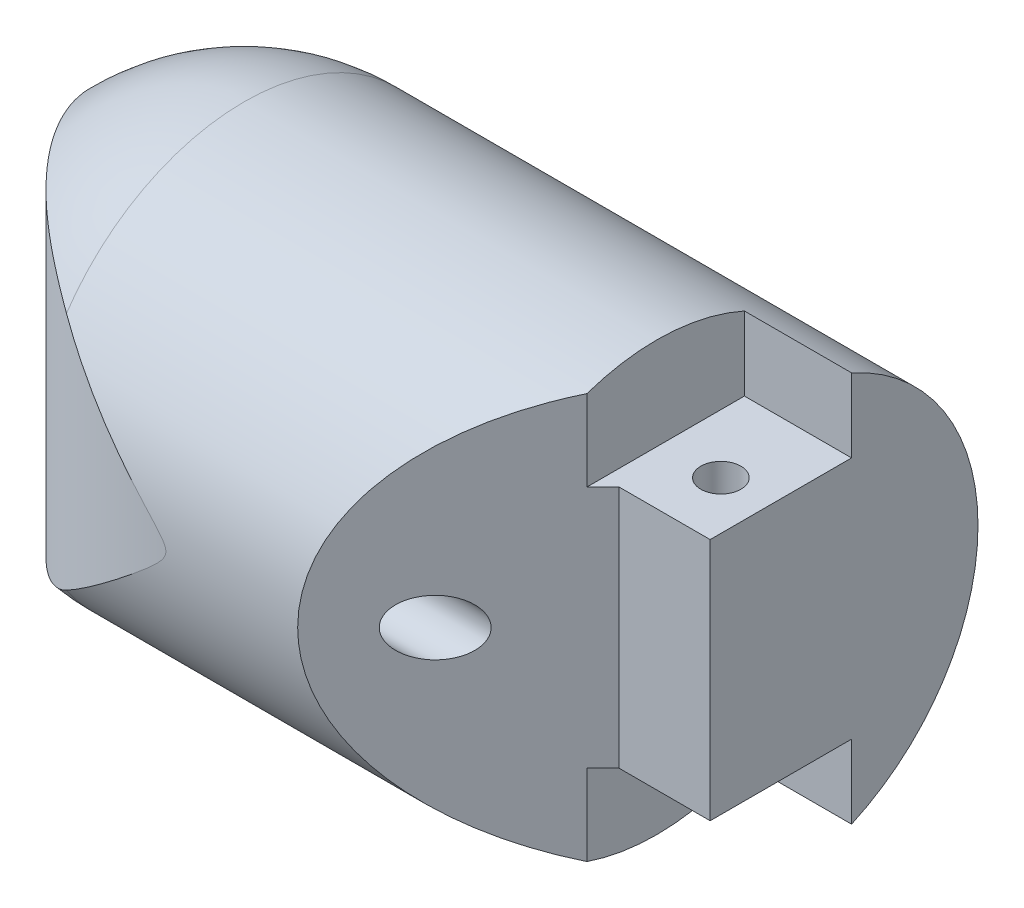
from build123d import *

# Parameters (mm, degrees)
SKETCH1_R                = 10
BOSS_EXTRUDE1_DEPTH      = 20
CUT_EXTRUDE10_DEPTH      = 12
CUT_EXTRUDE10_DEPTH_BACK = 12
CUT_SWEEP1_START         = -6.209273082
CUT_SWEEP1_OUTLINE_R     = 1.305
CUT_SWEEP1_DEPTH         = 3
CUT_SWEEP1_START_2       = 11.29177872
CUT_SWEEP1_2_OUTLINE_R   = 1.305
CUT_SWEEP1_2_DEPTH       = 8.70822128
CUT_SWEEP1_3_OUTLINE_R   = 1.305
CUT_SWEEP1_3_ANGLE       = 90
CUT_SWEEP2_START         = -11
CUT_SWEEP2_OUTLINE_R     = 2.5
CUT_SWEEP2_DEPTH         = 4.790726918
SKETCH25_W               = 5
SKETCH25_H               = 11.364916732
BOSS_EXTRUDE3_DEPTH      = 4.25
BOSS_EXTRUDE4_DEPTH      = 4.25
SKETCH27_R               = 0.935
CUT_EXTRUDE11_DEPTH      = 17.125
CUT_EXTRUDE12_START      = -0.75
CUT_EXTRUDE12_DEPTH      = 0.75
CUT_EXTRUDE13_DEPTH      = 10.375
SKETCH30_W               = 5
SKETCH30_H               = 4
CUT_EXTRUDE14_DEPTH      = 1.6
SCALE2_SCALE             = 0.8


with BuildPart() as part:
    # Sketch1 → Boss-Extrude1 (new body)
    with BuildSketch(Plane(origin=(0, 0, 0), x_dir=(0, 0, -1), z_dir=(1, 0, 0))):
        Circle(SKETCH1_R)
    extrude(amount=BOSS_EXTRUDE1_DEPTH)

    # Sketch12 → Revolve1 (revolve)
    with BuildSketch(Plane.XY):
        with BuildLine():
            Line((0, 10), (0, -10))
            ThreePointArc((0, -10), (-10, 0), (0, 10))
        make_face()
    revolve(axis=Axis((0, 10, 0), (0, -1, 0)))

    # Sketch13 → Cut-Extrude10 (cut, two sides: drawn at the far end of the back side and taken through both)
    with BuildSketch(Plane(origin=(0, 0, 0), x_dir=(1, 0, 0), z_dir=(0, 1, 0)).offset(-CUT_EXTRUDE10_DEPTH_BACK)):
        with BuildLine():
            ThreePointArc((-7.984675672, 6.020378262), (-3.764408562, -5.478068678), (7.618784032, -10))
            ThreePointArc((7.618784032, -10), (-7.804645707, -9.413161624), (-7.984675672, 6.020378262))
        make_face()
    extrude(amount=CUT_EXTRUDE10_DEPTH + CUT_EXTRUDE10_DEPTH_BACK, mode=Mode.SUBTRACT)

    # Cut-Sweep1: read off the stored shape, not the designer's step
    # Cut-Sweep1 outline → Cut-Sweep1 (cut)
    with BuildSketch(Plane.XY.offset(CUT_SWEEP1_START)):
        with Locations((1.29177882, 0)):
            Circle(CUT_SWEEP1_OUTLINE_R)
    extrude(amount=CUT_SWEEP1_DEPTH, mode=Mode.SUBTRACT)

    # Cut-Sweep1 2 outline → Cut-Sweep1 2 (cut)
    with BuildSketch(Plane.YZ.offset(CUT_SWEEP1_START_2)):
        with Locations((0, 6.790726918)):
            Circle(CUT_SWEEP1_2_OUTLINE_R)
    extrude(amount=CUT_SWEEP1_2_DEPTH, mode=Mode.SUBTRACT)

    # Cut-Sweep1 3 outline → Cut-Sweep1 3 (revolve, cut)
    with BuildSketch(Plane(origin=(11.29177882, 0, -3.209273082), x_dir=(-1, 0, 0), z_dir=(0, 0, -1))):
        with Locations((10, 0)):
            Circle(CUT_SWEEP1_3_OUTLINE_R)
    revolve(axis=Axis((11.29177882, 0, -3.209273082), (0, 1, 0)), revolution_arc=CUT_SWEEP1_3_ANGLE, mode=Mode.SUBTRACT)

    # Cut-Sweep2: read off the stored shape, not the designer's step
    # Cut-Sweep2 outline → Cut-Sweep2 (cut)
    with BuildSketch(Plane.XY.offset(CUT_SWEEP2_START)):
        with Locations((1.29177882, 0)):
            Circle(CUT_SWEEP2_OUTLINE_R)
    extrude(amount=CUT_SWEEP2_DEPTH, mode=Mode.SUBTRACT)

    # Sketch25 → Boss-Extrude3 (add)
    with BuildSketch(Plane(origin=(20, 0, 0), x_dir=(0, 0, -1), z_dir=(1, 0, 0))):
        Rectangle(SKETCH25_W, SKETCH25_H)
    extrude(amount=BOSS_EXTRUDE3_DEPTH)

    # Sketch26 → Boss-Extrude4 (add)
    with BuildSketch(Plane(origin=(20, 0, 0), x_dir=(0, 0, -1), z_dir=(1, 0, 0))):
        with BuildLine():
            Line((2.5, -9.682458366), (2.5, 9.682458366))
            ThreePointArc((2.5, 9.682458366), (10, 0), (2.5, -9.682458366))
        make_face()
    extrude(amount=BOSS_EXTRUDE4_DEPTH)

    # Sketch27 → Cut-Extrude11 (cut, symmetric)
    with BuildSketch(Plane(origin=(0, 0, 0), x_dir=(1, 0, 0), z_dir=(0, 1, 0))):
        with Locations(Location((22, 0.25, 0), (0, 0, 270))):
            Circle(SKETCH27_R)
    extrude(amount=CUT_EXTRUDE11_DEPTH, both=True, mode=Mode.SUBTRACT)

    # Sketch28 → Cut-Extrude12 (cut)
    with BuildSketch(Plane(origin=(20, 0, 0), x_dir=(0, 0, -1), z_dir=(1, 0, 0)).offset(CUT_EXTRUDE12_START)):
        with BuildLine():
            Line((2.5, -9.682458366), (2.5, -5.682458366))
            Line((2.5, -5.682458366), (-8.228588392, -5.682458366))
            ThreePointArc((-8.228588392, -5.682458366), (-3.493448331, -9.369942303), (2.5, -9.682458366))
        make_face()
        with BuildLine():
            Line((-8.228588392, 5.682458366), (2.5, 5.682458366))
            Line((2.5, 5.682458366), (2.5, 9.682458366))
            ThreePointArc((2.5, 9.682458366), (-3.493448331, 9.369942303), (-8.228588392, 5.682458366))
        make_face()
    extrude(amount=CUT_EXTRUDE12_DEPTH, mode=Mode.SUBTRACT)

    # Sketch29 → Cut-Extrude13 (cut, symmetric)
    with BuildSketch(Plane(origin=(0, 0, 0), x_dir=(1, 0, 0), z_dir=(0, 1, 0))):
        Polygon((20, -8.228588392), (20, -2.5), (12.5, -10), (20, -10), align=None)
    extrude(amount=CUT_EXTRUDE13_DEPTH, both=True, mode=Mode.SUBTRACT)

    # Sketch30 → Cut-Extrude14 (cut)
    with BuildSketch(Plane.XY.offset(-2.5)):
        with Locations((21.75, 7.682458366)):
            Rectangle(SKETCH30_W, SKETCH30_H)
        with Locations((21.75, -7.682458366)):
            Rectangle(SKETCH30_W, SKETCH30_H)
    extrude(amount=-CUT_EXTRUDE14_DEPTH, mode=Mode.SUBTRACT)


with BuildPart() as part_1:
    # Scale2: scaled about (8.050299805, 3.9953e-05, -0.823625188)
    add(part.part.scale(SCALE2_SCALE).moved(Location((1.610059961, 7.991e-06, -0.164725038))))


solid = part_1.part
